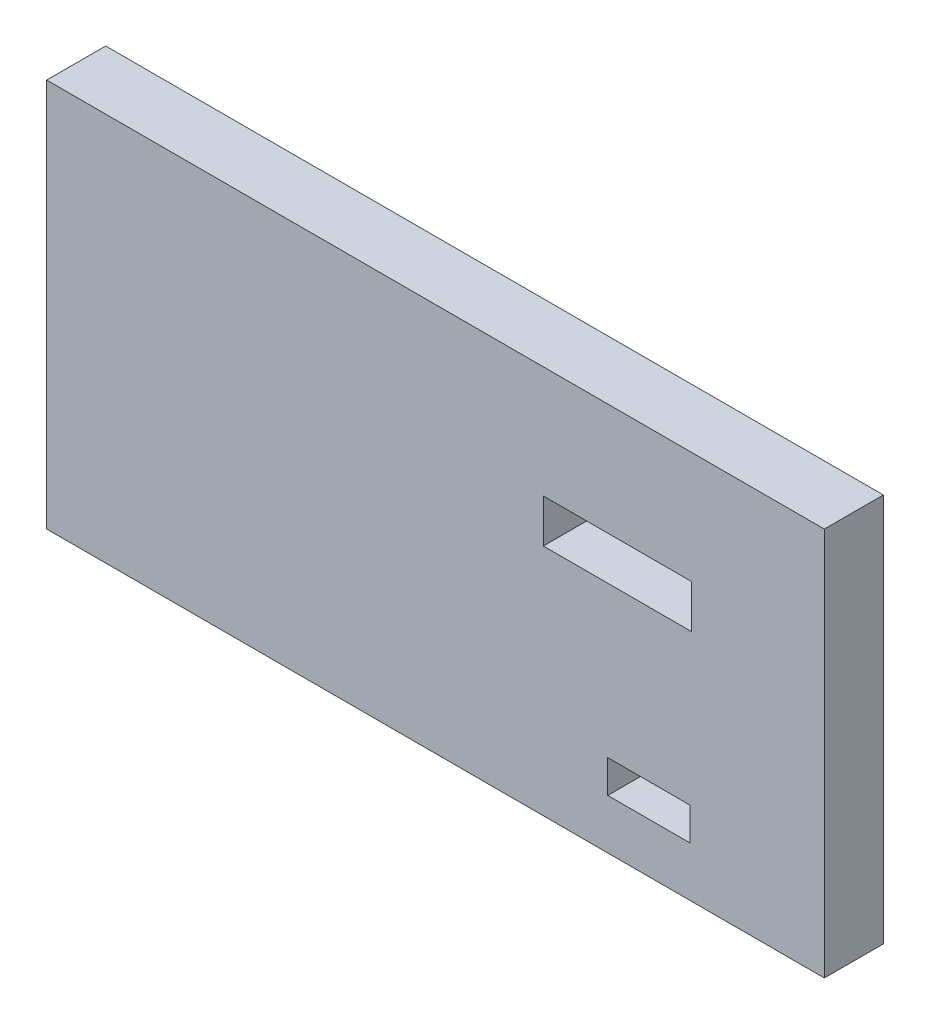
from build123d import *

# Parameters (mm, degrees)
SKETCH1_W           = 131.78232807
SKETCH1_H           = 65.891164035
SKETCH1_W_2         = 25.122990279
SKETCH1_H_2         = 7.346433981
BOSS_EXTRUDE1_DEPTH = 10
SKETCH3_W           = 13.913107457
SKETCH3_H           = 5.54880997
CUT_EXTRUDE1_DEPTH  = 10


with BuildPart() as part:
    # Sketch1 → Boss-Extrude1 (new body)
    with BuildSketch(Plane.XY):
        with Locations((65.891164035, 32.945582018)):
            Rectangle(SKETCH1_W, SKETCH1_H)
        with Locations((96.72804741, 43.262333441)):
            Rectangle(SKETCH1_W_2, SKETCH1_H_2, mode=Mode.SUBTRACT)
    extrude(amount=BOSS_EXTRUDE1_DEPTH)

    # Sketch3 → Cut-Extrude1 (cut)
    with BuildSketch(Plane.XY.offset(10)):
        with Locations((102.035863776, 11.216052252)):
            Rectangle(SKETCH3_W, SKETCH3_H)
    extrude(amount=-CUT_EXTRUDE1_DEPTH, mode=Mode.SUBTRACT)


solid = part.part
